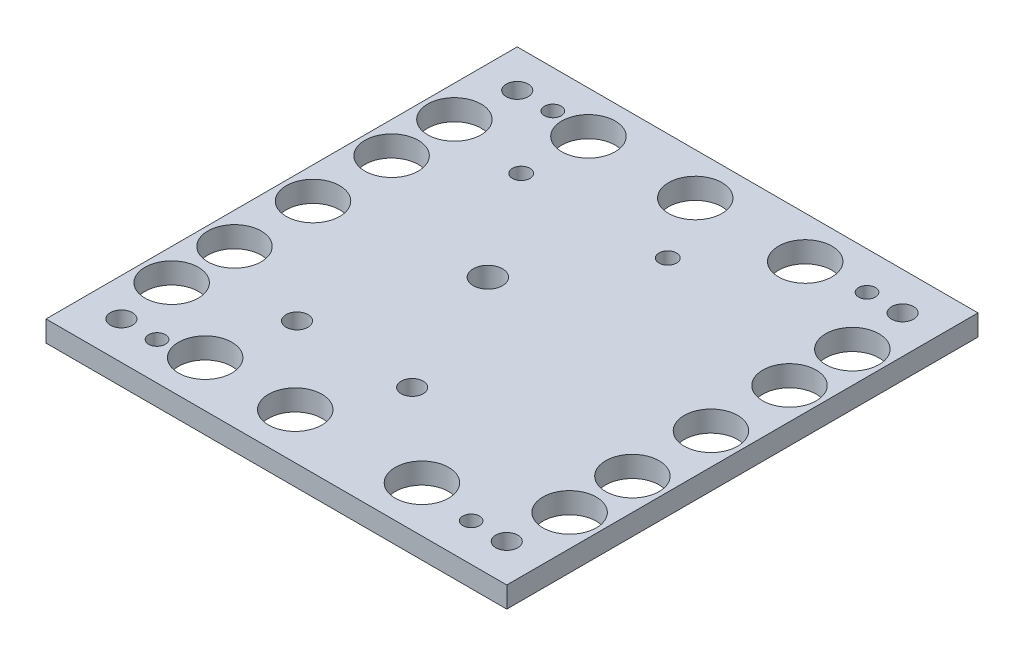
from build123d import *

# Parameters (mm, degrees)
SKETCH1_W             = 220
SKETCH1_H             = 225
BOSS_EXTRUDE1_DEPTH   = 10
CUT_EXTRUDE1_REACH    = 159.659
SKETCH2_R             = 12.75
CUT_EXTRUDE2_REACH    = 159.659
SKETCH3_R             = 7
F_8_0MM_DOWEL_HOLE1_D = 8
M10_CLEARANCE_HOLE1_D = 10.5
M10_CLEARANCE_HOLE2_D = 10.5
M8_CLEARANCE_HOLE1_D  = 8.4


with BuildPart() as part:
    # Sketch1 → Boss-Extrude1 (new body)
    with BuildSketch(Plane(origin=(0, 0, 0), x_dir=(1, 0, 0), z_dir=(0, 1, 0))):
        Rectangle(SKETCH1_W, SKETCH1_H)
    extrude(amount=BOSS_EXTRUDE1_DEPTH)

    # Sketch2 → Cut-Extrude1 (cut, up to next)
    with BuildSketch(Plane.XZ, mode=Mode.PRIVATE) as cut_extrude1_sk1:
        with Locations((-56, 90.5)):
            Circle(SKETCH2_R)
    cut_extrude1_tool1 = extrude(cut_extrude1_sk1.sketch, amount=-CUT_EXTRUDE1_REACH, mode=Mode.PRIVATE) & part.part
    # Sketch2 → Cut-Extrude1 (cut, up to next)
    with BuildSketch(Plane.XZ, mode=Mode.PRIVATE) as cut_extrude1_sk2:
        with Locations((-13, 90.5)):
            Circle(SKETCH2_R)
    cut_extrude1_tool2 = extrude(cut_extrude1_sk2.sketch, amount=-CUT_EXTRUDE1_REACH, mode=Mode.PRIVATE) & part.part
    # Sketch2 → Cut-Extrude1 (cut, up to next)
    with BuildSketch(Plane.XZ, mode=Mode.PRIVATE) as cut_extrude1_sk3:
        with Locations((47.5, 90.5)):
            Circle(SKETCH2_R)
    cut_extrude1_tool3 = extrude(cut_extrude1_sk3.sketch, amount=-CUT_EXTRUDE1_REACH, mode=Mode.PRIVATE) & part.part
    # Sketch2 → Cut-Extrude1 (cut, up to next)
    with BuildSketch(Plane.XZ, mode=Mode.PRIVATE) as cut_extrude1_sk4:
        with Locations((95, 67.5)):
            Circle(SKETCH2_R)
    cut_extrude1_tool4 = extrude(cut_extrude1_sk4.sketch, amount=-CUT_EXTRUDE1_REACH, mode=Mode.PRIVATE) & part.part
    # Sketch2 → Cut-Extrude1 (cut, up to next)
    with BuildSketch(Plane.XZ, mode=Mode.PRIVATE) as cut_extrude1_sk5:
        with Locations((95, 37.5)):
            Circle(SKETCH2_R)
    cut_extrude1_tool5 = extrude(cut_extrude1_sk5.sketch, amount=-CUT_EXTRUDE1_REACH, mode=Mode.PRIVATE) & part.part
    # Sketch2 → Cut-Extrude1 (cut, up to next)
    with BuildSketch(Plane.XZ, mode=Mode.PRIVATE) as cut_extrude1_sk6:
        with Locations((95, 0)):
            Circle(SKETCH2_R)
    cut_extrude1_tool6 = extrude(cut_extrude1_sk6.sketch, amount=-CUT_EXTRUDE1_REACH, mode=Mode.PRIVATE) & part.part
    # Sketch2 → Cut-Extrude1 (cut, up to next)
    with BuildSketch(Plane.XZ, mode=Mode.PRIVATE) as cut_extrude1_sk7:
        with Locations((95, -37.5)):
            Circle(SKETCH2_R)
    cut_extrude1_tool7 = extrude(cut_extrude1_sk7.sketch, amount=-CUT_EXTRUDE1_REACH, mode=Mode.PRIVATE) & part.part
    # Sketch2 → Cut-Extrude1 (cut, up to next)
    with BuildSketch(Plane.XZ, mode=Mode.PRIVATE) as cut_extrude1_sk8:
        with Locations((95, -67.5)):
            Circle(SKETCH2_R)
    cut_extrude1_tool8 = extrude(cut_extrude1_sk8.sketch, amount=-CUT_EXTRUDE1_REACH, mode=Mode.PRIVATE) & part.part
    # Sketch2 → Cut-Extrude1 (cut, up to next)
    with BuildSketch(Plane.XZ, mode=Mode.PRIVATE) as cut_extrude1_sk9:
        with Locations((47.5, -92.5)):
            Circle(SKETCH2_R)
    cut_extrude1_tool9 = extrude(cut_extrude1_sk9.sketch, amount=-CUT_EXTRUDE1_REACH, mode=Mode.PRIVATE) & part.part
    # Sketch2 → Cut-Extrude1 (cut, up to next)
    with BuildSketch(Plane.XZ, mode=Mode.PRIVATE) as cut_extrude1_sk10:
        with Locations((-5, -92.5)):
            Circle(SKETCH2_R)
    cut_extrude1_tool10 = extrude(cut_extrude1_sk10.sketch, amount=-CUT_EXTRUDE1_REACH, mode=Mode.PRIVATE) & part.part
    # Sketch2 → Cut-Extrude1 (cut, up to next)
    with BuildSketch(Plane.XZ, mode=Mode.PRIVATE) as cut_extrude1_sk11:
        with Locations((-56, -92.5)):
            Circle(SKETCH2_R)
    cut_extrude1_tool11 = extrude(cut_extrude1_sk11.sketch, amount=-CUT_EXTRUDE1_REACH, mode=Mode.PRIVATE) & part.part
    # Sketch2 → Cut-Extrude1 (cut, up to next)
    with BuildSketch(Plane.XZ, mode=Mode.PRIVATE) as cut_extrude1_sk12:
        with Locations((-95, -67.5)):
            Circle(SKETCH2_R)
    cut_extrude1_tool12 = extrude(cut_extrude1_sk12.sketch, amount=-CUT_EXTRUDE1_REACH, mode=Mode.PRIVATE) & part.part
    # Sketch2 → Cut-Extrude1 (cut, up to next)
    with BuildSketch(Plane.XZ, mode=Mode.PRIVATE) as cut_extrude1_sk13:
        with Locations((-95, -37.5)):
            Circle(SKETCH2_R)
    cut_extrude1_tool13 = extrude(cut_extrude1_sk13.sketch, amount=-CUT_EXTRUDE1_REACH, mode=Mode.PRIVATE) & part.part
    # Sketch2 → Cut-Extrude1 (cut, up to next)
    with BuildSketch(Plane.XZ, mode=Mode.PRIVATE) as cut_extrude1_sk14:
        with Locations((-95, 0)):
            Circle(SKETCH2_R)
    cut_extrude1_tool14 = extrude(cut_extrude1_sk14.sketch, amount=-CUT_EXTRUDE1_REACH, mode=Mode.PRIVATE) & part.part
    # Sketch2 → Cut-Extrude1 (cut, up to next)
    with BuildSketch(Plane.XZ, mode=Mode.PRIVATE) as cut_extrude1_sk15:
        with Locations((-95, 37.5)):
            Circle(SKETCH2_R)
    cut_extrude1_tool15 = extrude(cut_extrude1_sk15.sketch, amount=-CUT_EXTRUDE1_REACH, mode=Mode.PRIVATE) & part.part
    # Sketch2 → Cut-Extrude1 (cut, up to next)
    with BuildSketch(Plane.XZ, mode=Mode.PRIVATE) as cut_extrude1_sk16:
        with Locations((-95, 67.5)):
            Circle(SKETCH2_R)
    cut_extrude1_tool16 = extrude(cut_extrude1_sk16.sketch, amount=-CUT_EXTRUDE1_REACH, mode=Mode.PRIVATE) & part.part
    add(cut_extrude1_tool1.solids().sort_by_distance((-56, 0, 90.5))[0], mode=Mode.SUBTRACT)
    add(cut_extrude1_tool2.solids().sort_by_distance((-13, 0, 90.5))[0], mode=Mode.SUBTRACT)
    add(cut_extrude1_tool3.solids().sort_by_distance((47.5, 0, 90.5))[0], mode=Mode.SUBTRACT)
    add(cut_extrude1_tool4.solids().sort_by_distance((95, 0, 67.5))[0], mode=Mode.SUBTRACT)
    add(cut_extrude1_tool5.solids().sort_by_distance((95, 0, 37.5))[0], mode=Mode.SUBTRACT)
    add(cut_extrude1_tool6.solids().sort_by_distance((95, 0, 0))[0], mode=Mode.SUBTRACT)
    add(cut_extrude1_tool7.solids().sort_by_distance((95, 0, -37.5))[0], mode=Mode.SUBTRACT)
    add(cut_extrude1_tool8.solids().sort_by_distance((95, 0, -67.5))[0], mode=Mode.SUBTRACT)
    add(cut_extrude1_tool9.solids().sort_by_distance((47.5, 0, -92.5))[0], mode=Mode.SUBTRACT)
    add(cut_extrude1_tool10.solids().sort_by_distance((-5, 0, -92.5))[0], mode=Mode.SUBTRACT)
    add(cut_extrude1_tool11.solids().sort_by_distance((-56, 0, -92.5))[0], mode=Mode.SUBTRACT)
    add(cut_extrude1_tool12.solids().sort_by_distance((-95, 0, -67.5))[0], mode=Mode.SUBTRACT)
    add(cut_extrude1_tool13.solids().sort_by_distance((-95, 0, -37.5))[0], mode=Mode.SUBTRACT)
    add(cut_extrude1_tool14.solids().sort_by_distance((-95, 0, 0))[0], mode=Mode.SUBTRACT)
    add(cut_extrude1_tool15.solids().sort_by_distance((-95, 0, 37.5))[0], mode=Mode.SUBTRACT)
    add(cut_extrude1_tool16.solids().sort_by_distance((-95, 0, 67.5))[0], mode=Mode.SUBTRACT)

    # Sketch3 → Cut-Extrude2 (cut, up to next)
    with BuildSketch(Plane.XZ, mode=Mode.PRIVATE) as cut_extrude2_sk1:
        with Locations((-21.75, -10.23)):
            Circle(SKETCH3_R)
    cut_extrude2_tool1 = extrude(cut_extrude2_sk1.sketch, amount=-CUT_EXTRUDE2_REACH, mode=Mode.PRIVATE) & part.part
    add(cut_extrude2_tool1.solids().sort_by_distance((-21.75, 0, -10.23))[0], mode=Mode.SUBTRACT)

    # Ø8.0mm Dowel Hole1 (through all)
    with Locations(Plane(origin=(0, 10, 0), x_dir=(1, 0, 0), z_dir=(0, 1, 0))):
        with Locations((75, -94.5), (-75, -94.5), (75, 94.5), (-75, 94.5)):
            Hole(F_8_0MM_DOWEL_HOLE1_D / 2)

    # M10 Clearance Hole1 (through all)
    with Locations(Plane(origin=(0, 10, 0), x_dir=(1, 0, 0), z_dir=(0, 1, 0))):
        with Locations((92, -94.5), (92, 94.5), (-92, 94.5), (-92, -94.5)):
            Hole(M10_CLEARANCE_HOLE1_D / 2)

    # M10 Clearance Hole2 (through all)
    with Locations(Plane(origin=(0, 10, 0), x_dir=(1, 0, 0), z_dir=(0, 1, 0))):
        with Locations((5.75, -53.4), (-49.25, -53.4)):
            Hole(M10_CLEARANCE_HOLE2_D / 2)

    # M8 Clearance Hole1 (through all)
    with Locations(Plane(origin=(0, 10, 0), x_dir=(1, 0, 0), z_dir=(0, 1, 0))):
        with Locations((13.25, 61.13), (-56.75, 61.13)):
            Hole(M8_CLEARANCE_HOLE1_D / 2)


solid = part.part
